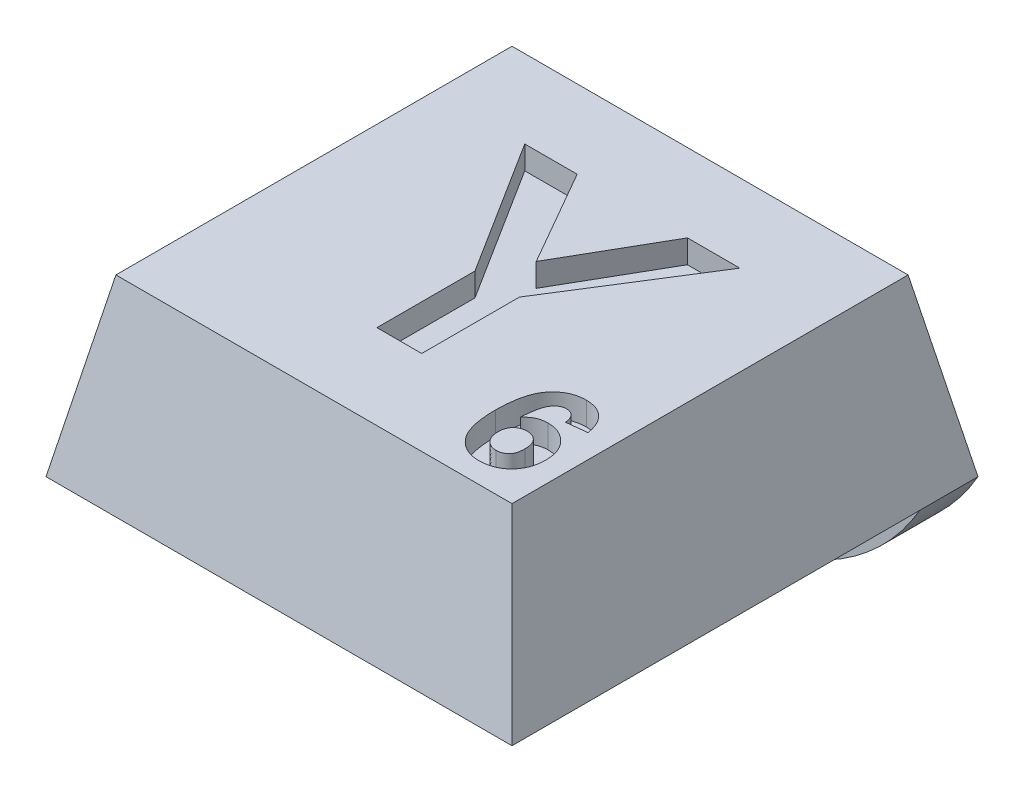
from build123d import *

# Parameters (mm, degrees)
SKETCH1_W               = 8
SKETCH1_H               = 8
BOSS_EXTRUDE1_DEPTH     = 3
CUT_EXTRUDE1_DEPTH      = 12.704699911
CUT_EXTRUDE1_DEPTH_BACK = 12.704699911
CUT_EXTRUDE2_DEPTH      = 11
SKETCH4_R               = 1.8
CUT_EXTRUDE3_DEPTH      = 0.8
SKETCH5_W               = 8
SKETCH5_H               = 1
BOSS_EXTRUDE2_DEPTH     = 2
FILLET1_R               = 4
CUT_EXTRUDE4_DEPTH      = 0.4
CUT_EXTRUDE5_DEPTH      = 0.4


with BuildPart() as part:
    # Sketch1 → Boss-Extrude1 (new body)
    with BuildSketch(Plane(origin=(0, 0, 0), x_dir=(1, 0, 0), z_dir=(0, 1, 0))):
        with Locations((4, 4)):
            Rectangle(SKETCH1_W, SKETCH1_H)
    extrude(amount=BOSS_EXTRUDE1_DEPTH)

    # Sketch2 → Cut-Extrude1 (cut, two sides: drawn at the far end of the back side and taken through both)
    with BuildSketch(Plane.XY.offset(-CUT_EXTRUDE1_DEPTH_BACK)):
        Polygon((0, 0), (0.6, 3), (0, 3), align=None)
        Polygon((8, 0), (7.4, 3), (8, 3), align=None)
    extrude(amount=CUT_EXTRUDE1_DEPTH + CUT_EXTRUDE1_DEPTH_BACK, mode=Mode.SUBTRACT)

    # Sketch3 → Cut-Extrude2 (cut)
    with BuildSketch(Plane(origin=(0, 0, 0), x_dir=(0, 0, -1), z_dir=(1, 0, 0))):
        Polygon((0, 0), (0.6, 3), (0, 3), align=None)
        Polygon((8, 3), (7.4, 3), (8, 0), align=None)
    extrude(amount=CUT_EXTRUDE2_DEPTH, mode=Mode.SUBTRACT)

    # Sketch4 → Cut-Extrude3 (cut)
    with BuildSketch(Plane.XZ):
        with Locations(Location((4, -3.75, 0), (0, 0, 270))):
            Circle(SKETCH4_R)
    extrude(amount=-CUT_EXTRUDE3_DEPTH, mode=Mode.SUBTRACT)

    # Sketch5 → Boss-Extrude2 (add)
    with BuildSketch(Plane.XZ):
        with Locations((4, -7.5)):
            Rectangle(SKETCH5_W, SKETCH5_H)
    extrude(amount=BOSS_EXTRUDE2_DEPTH)

    # Fillet1
    # the kernel refuses this fillet: 4 mm, written as the material it takes off along each edge
    with BuildSketch(Plane(origin=(8, -2, -16.660254038), x_dir=(0, 1, 0), z_dir=(0, 0, 1)), Plane(origin=(0, -2, 1.660254038), x_dir=(0, 1, 0), z_dir=(0, 0, -1))) as fillet1_piece_1:
        with BuildLine():
            CenterArc((4, 3.464101615), FILLET1_R, 180, 60)
            Line((0, 3.464101615), (-0.08, 3.464101615))
            Line((-0.08, 3.464101615), (-0.08, 0))
            Line((-0.08, 0), (0, -0.08))
            ThreePointArc((0, -0.08), (1, -0.08), (1.96, -0.069282032))
            Line((1.96, -0.069282032), (2, 0))
        make_face()
    extrude(amount=18.320508076, mode=Mode.SUBTRACT)

    # Sketch6 → Cut-Extrude4 (cut)
    with BuildSketch(Plane(origin=(0, 3, 0), x_dir=(1, 0, 0), z_dir=(0, 1, 0))):
        Polygon((3.623842243, 2.056832464), (3.623842243, 3.740326053), (2.162303782, 6.056832464), (3.062143525, 6.056832464), (4.007656346, 4.408595284), (4.95477173, 6.056832464), (5.854611474, 6.056832464), (4.393073013, 3.734717079), (4.393073013, 2.056832464), align=None)
    extrude(amount=-CUT_EXTRUDE4_DEPTH, mode=Mode.SUBTRACT)

    # Sketch7 → Cut-Extrude5 (cut)
    with BuildSketch(Plane(origin=(0, 3, 0), x_dir=(1, 0, 0), z_dir=(0, 1, 0))):
        with BuildLine():
            Line((6.99657775, 2.307478491), (6.650423904, 2.269617914))
            add(Edge.make_bspline(
                [(6.650423904, 2.269617914), (6.648104786, 2.286290214), (6.643740629, 2.317664439), (6.630814222, 2.360960848), (6.6128192, 2.397384178), (6.589720846, 2.426985356), (6.562208273, 2.449767653), (6.53085918, 2.465955864), (6.495693494, 2.475565581), (6.471038508, 2.476713937), (6.458236404, 2.477310221)],
                knots=[0, 0, 0, 0, 1.280716388, 2.410074291, 3.425374506, 4.35753932, 5.248331359, 6.12451615, 7.026154803, 8, 8, 8, 8], degree=3))
            add(Edge.make_bspline(
                [(6.458236404, 2.477310221), (6.449554942, 2.477097941), (6.432279271, 2.476675513), (6.407115159, 2.471312362), (6.382853927, 2.463353411), (6.359693582, 2.452081234), (6.337518567, 2.437536581), (6.316665994, 2.419545601), (6.296177185, 2.39905664), (6.277258092, 2.37431526), (6.259107425, 2.34501973), (6.243478966, 2.309156475), (6.229549311, 2.266758815), (6.217622545, 2.217619097), (6.206799126, 2.162049229), (6.197926997, 2.099824257), (6.190827571, 2.030888275), (6.1874217, 1.982610246), (6.18564025, 1.957358298)],
                knots=[0, 0, 0, 0, 0.642458078, 1.278459126, 1.898279436, 2.531842133, 3.181731979, 3.858193002, 4.57010051, 5.325711302, 6.161524323, 7.118599443, 8.217371811, 9.466325973, 10.864147948, 12.412648259, 14.123626419, 16, 16, 16, 16], degree=3))
            add(Edge.make_bspline(
                [(6.18564025, 1.957358298), (6.196703374, 1.969374309), (6.218396997, 1.992936442), (6.254393564, 2.023656049), (6.292105324, 2.049919261), (6.331942634, 2.071465901), (6.374122941, 2.087500286), (6.417882183, 2.099674887), (6.463793169, 2.1064945), (6.494994081, 2.107544715), (6.510880634, 2.108079452)],
                knots=[0, 0, 0, 0, 1.057745406, 2.074127497, 3.059409796, 4.031705469, 5.000875988, 5.977809597, 6.970362319, 8, 8, 8, 8], degree=3))
            add(Edge.make_bspline(
                [(6.510880634, 2.108079452), (6.528809934, 2.107563089), (6.564213931, 2.106543456), (6.616372239, 2.099391957), (6.666421561, 2.086532277), (6.714588312, 2.069136373), (6.761110551, 2.047230594), (6.805098359, 2.019501147), (6.847242227, 1.987169858), (6.886962554, 1.950231753), (6.923455982, 1.909566001), (6.95567607, 1.865643773), (6.982192143, 1.818330938), (7.00486021, 1.76868676), (7.021726117, 1.715731209), (7.033968982, 1.660226315), (7.04127711, 1.601662587), (7.042239139, 1.561706039), (7.042731596, 1.541252529)],
                knots=[0, 0, 0, 0, 0.99135015, 1.957564468, 2.903754199, 3.843479786, 4.78583385, 5.741106244, 6.712813504, 7.719198368, 8.735844933, 9.730198001, 10.724351158, 11.729813921, 12.742848014, 13.790983496, 14.86921809, 16, 16, 16, 16], degree=3))
            add(Edge.make_bspline(
                [(7.042731596, 1.541252529), (7.042231952, 1.519599685), (7.041257525, 1.477371451), (7.034085066, 1.415527203), (7.021415455, 1.357153196), (7.004106031, 1.301781092), (6.981716795, 1.249849655), (6.954594052, 1.200930916), (6.921819947, 1.155860856), (6.884881845, 1.114033218), (6.84370317, 1.076707467), (6.799818397, 1.043655074), (6.752740779, 1.016179585), (6.703166183, 0.993054256), (6.650243128, 0.9760833), (6.594904638, 0.963355935), (6.536700741, 0.955593381), (6.496962304, 0.954693712), (6.476625827, 0.954233298)],
                knots=[0, 0, 0, 0, 1.13287417, 2.209376133, 3.25169942, 4.254157582, 5.240146322, 6.205890558, 7.174579019, 8.150183866, 9.1206468, 10.07783463, 11.019441811, 11.967766696, 12.934309213, 13.921380422, 14.936249089, 16, 16, 16, 16], degree=3))
            add(Edge.make_bspline(
                [(6.476625827, 0.954233298), (6.454835686, 0.954842926), (6.411992392, 0.956041562), (6.349274568, 0.965905733), (6.289647802, 0.982594351), (6.233119501, 1.005900716), (6.179219819, 1.035216515), (6.128449255, 1.071632083), (6.080942348, 1.114800151), (6.036070744, 1.164136126), (5.995238787, 1.221123075), (5.960465944, 1.286988003), (5.930975089, 1.361009558), (5.906965213, 1.443377578), (5.888431321, 1.534085529), (5.875498792, 1.633141016), (5.86690889, 1.740380226), (5.866183985, 1.814672002), (5.865808519, 1.853151567)],
                knots=[0, 0, 0, 0, 0.852151446, 1.675481364, 2.476404467, 3.269281233, 4.062617998, 4.871616733, 5.707301388, 6.56955125, 7.476395267, 8.442009786, 9.475854496, 10.58877921, 11.794095973, 13.094195288, 14.494932947, 16, 16, 16, 16], degree=3))
            add(Edge.make_bspline(
                [(5.865808519, 1.853151567), (5.866346697, 1.892590697), (5.867386586, 1.968796599), (5.875754473, 2.078827487), (5.889046125, 2.180436336), (5.908408745, 2.273394012), (5.933175033, 2.357893394), (5.963200156, 2.434104295), (5.99923844, 2.501750812), (6.041138584, 2.560612949), (6.087240817, 2.61177964), (6.136777869, 2.655945181), (6.189560624, 2.693536639), (6.245587817, 2.724459089), (6.305319384, 2.747901225), (6.368188753, 2.764829378), (6.434301522, 2.775708833), (6.479587723, 2.776770851), (6.502587365, 2.777310221)],
                knots=[0, 0, 0, 0, 1.491699013, 2.882321987, 4.171520357, 5.365488089, 6.470299549, 7.49861535, 8.458736801, 9.361983288, 10.224742848, 11.058789056, 11.867429157, 12.671146298, 13.473202851, 14.288259215, 15.130652936, 16, 16, 16, 16], degree=3))
            add(Edge.make_bspline(
                [(6.502587365, 2.777310221), (6.518832845, 2.777017956), (6.550590682, 2.776446616), (6.597136362, 2.770379458), (6.641540508, 2.76110179), (6.683919501, 2.748259344), (6.723974963, 2.731060825), (6.761865954, 2.710109046), (6.797719857, 2.685460752), (6.831350121, 2.657274635), (6.862486078, 2.625465393), (6.890601127, 2.589961055), (6.915881459, 2.551190115), (6.938437714, 2.509184749), (6.957357529, 2.46354265), (6.973622233, 2.414622738), (6.98699882, 2.362319913), (6.993336088, 2.326037695), (6.99657775, 2.307478491)],
                knots=[0, 0, 0, 0, 1.036027791, 2.025301876, 2.989435482, 3.928225244, 4.845595412, 5.765526461, 6.686607585, 7.61747015, 8.561102691, 9.521661062, 10.50224679, 11.510949117, 12.559251378, 13.650572309, 14.798212656, 16, 16, 16, 16], degree=3))
        make_face()
        with BuildLine():
            add(Edge.make_bspline(
                [(6.211962365, 1.549185221), (6.212093793, 1.537753077), (6.212350595, 1.515415322), (6.216561681, 1.483001611), (6.222614755, 1.452614338), (6.230767911, 1.42408476), (6.242068736, 1.397844656), (6.255476173, 1.373367715), (6.271335314, 1.350875727), (6.295669246, 1.324486058), (6.329294099, 1.29676891), (6.373421783, 1.272086886), (6.420703408, 1.256744198), (6.453316703, 1.255075433), (6.469774865, 1.254233298)],
                knots=[0, 0, 0, 0, 0.93816693, 1.833124408, 2.679057427, 3.481731691, 4.264557977, 5.020023694, 5.770442996, 6.518065735, 7.962605608, 9.32780964, 10.651490302, 12, 12, 12, 12], degree=3))
            add(Edge.make_bspline(
                [(6.469774865, 1.254233298), (6.485365796, 1.254933043), (6.51571185, 1.256295021), (6.559046727, 1.268742487), (6.598409917, 1.288373431), (6.627266187, 1.311420354), (6.647387039, 1.333836313), (6.660907792, 1.353494474), (6.671913698, 1.375919542), (6.680911589, 1.400742183), (6.688159323, 1.427866383), (6.693107691, 1.457564676), (6.69591447, 1.48975573), (6.696351403, 1.512040132), (6.69657775, 1.52358426)],
                knots=[0, 0, 0, 0, 1.399678333, 2.724321989, 4.020062797, 5.33532049, 6.016755754, 6.724441967, 7.473839083, 8.257094862, 9.096253071, 9.995581596, 10.961638663, 12, 12, 12, 12], degree=3))
            add(Edge.make_bspline(
                [(6.69657775, 1.52358426), (6.696384678, 1.535490976), (6.696011412, 1.558510238), (6.692745041, 1.591780733), (6.687401372, 1.622537963), (6.679930507, 1.650999261), (6.669817892, 1.676783929), (6.657887501, 1.700412041), (6.643402955, 1.721242874), (6.621876525, 1.745742616), (6.590576263, 1.770429427), (6.548753213, 1.792915191), (6.501874013, 1.805662518), (6.469248141, 1.807258544), (6.452467173, 1.808079452)],
                knots=[0, 0, 0, 0, 1.008384627, 1.949510571, 2.828269698, 3.650667555, 4.437180943, 5.170285793, 5.887596972, 6.580056709, 7.926803404, 9.238379296, 10.579573008, 12, 12, 12, 12], degree=3))
            add(Edge.make_bspline(
                [(6.452467173, 1.808079452), (6.436151813, 1.807414866), (6.404464825, 1.806124136), (6.358926875, 1.793162443), (6.31725918, 1.772538153), (6.286568407, 1.748308757), (6.264936989, 1.725473324), (6.25076935, 1.706030549), (6.238437114, 1.684862342), (6.228698053, 1.661421349), (6.221189386, 1.636147459), (6.215803903, 1.608867965), (6.212544961, 1.579673333), (6.212160051, 1.559530412), (6.211962365, 1.549185221)],
                knots=[0, 0, 0, 0, 1.469034193, 2.853094746, 4.235454457, 5.641396914, 6.354997179, 7.06867986, 7.807229614, 8.560602297, 9.353235934, 10.182779392, 11.06669468, 12, 12, 12, 12], degree=3))
        make_face(mode=Mode.SUBTRACT)
    extrude(amount=-CUT_EXTRUDE5_DEPTH, mode=Mode.SUBTRACT)


solid = part.part
